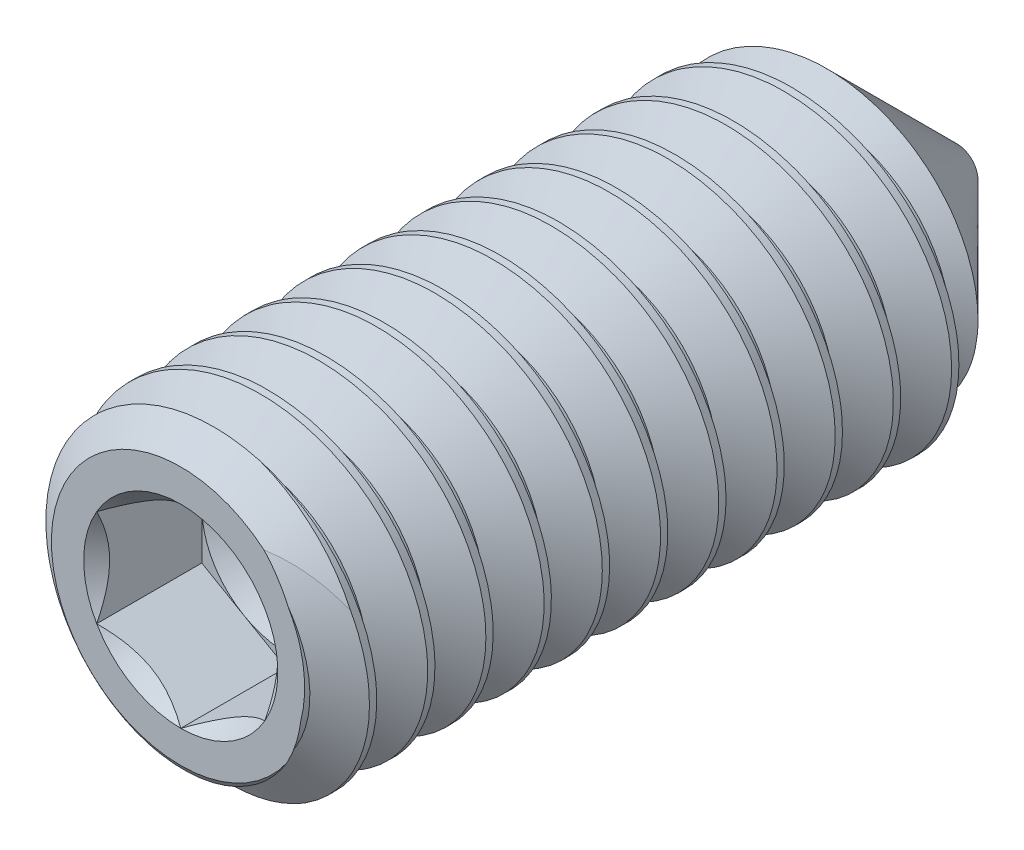
from build123d import *

# Parameters (mm, degrees)
HEX_EXTRUDE_DEPTH  = 0.8125
THREAD_SWEEP_PITCH = 0.45


with BuildPart() as part:
    # Body Sketch → Body Revolve (revolve)
    with BuildSketch(Plane(origin=(0, 0, 0), x_dir=(0, 0, -1), z_dir=(1, 0, 0)), mode=Mode.PRIVATE) as body_revolve_sk:
        Polygon((-3, 0), (-3, 1), (-2.824948115, 1.25), (1.9125, 1.25), (3, 0.1625), (3, 0), align=None)
    revolve(body_revolve_sk.sketch.rotate(Axis((0, 0, -3), (0, 0, 1)), 90), axis=Axis((0, 0, -3), (0, 0, 1)))

    # Hex Sketch → Hex Extrude (cut)
    with BuildSketch(Plane.XY.offset(3)):
        Polygon((0, 0.75055535), (-0.65, 0.375277675), (-0.65, -0.375277675), (0, -0.75055535), (0.65, -0.375277675), (0.65, 0.375277675), align=None)
    extrude(amount=-HEX_EXTRUDE_DEPTH, mode=Mode.SUBTRACT)

    # Hex Entry Extrude cone 1 section (through the dimple's axis) → Hex Entry Extrude (revolve, cut)
    with BuildSketch(Plane(origin=(0, 0, 3), x_dir=(0, -1, 0), z_dir=(1, 0, 0))):
        Polygon((0, 0), (0.75055535, 0), (0, 0.75055535), align=None)
    revolve(axis=Axis((0, 0, 3), (0, 0, -1)), mode=Mode.SUBTRACT)

    # Hex Bottom Extrude cone 1 section (through the dimple's axis) → Hex Bottom Extrude (revolve, cut)
    with BuildSketch(Plane(origin=(0, 0, 2.1875), x_dir=(0, -1, 0), z_dir=(1, 0, 0))):
        Polygon((0, 0), (0.65, 0), (0, 0.375277675), align=None)
    revolve(axis=Axis((0, 0, 2.1875), (0, 0, -1)), mode=Mode.SUBTRACT)

    # Thread Sweep: the profile of Sketch28 profile screwed along a right-hand helix of 14.333333 turns, 6 arcs to a turn; built about Z, then put on its axis
    thread_sweep_z = Axis((0, 0, 0), (0, 0, 1))
    thread_sweep_corners = [(1.2503, 0, 0.000173205), (1.2503, 0, -0.393923205), (0.957716426, 0, -0.225), (0.957716426, 0, -0.16875)]
    with BuildLine(mode=Mode.PRIVATE) as thread_sweep_profile:
        Line(thread_sweep_corners[0], thread_sweep_corners[1])
        Line(thread_sweep_corners[1], thread_sweep_corners[2])
        Line(thread_sweep_corners[2], thread_sweep_corners[3])
        Line(thread_sweep_corners[3], thread_sweep_corners[0])
    thread_sweep_cap = Face(thread_sweep_profile.wire())
    thread_sweep_turn_angles = [0, 30, 60, 90, 120, 150, 180, 210, 240, 270, 300, 330, 360]
    thread_sweep_turn_weights = [1, 0.8660254037844387, 1, 0.8660254037844387, 1, 0.8660254037844387, 1, 0.8660254037844387, 1, 0.8660254037844387, 1, 0.8660254037844387, 1]
    thread_sweep_turn_rails = [Edge.make_bspline([Vector(p[0], p[1], 0).rotate(thread_sweep_z, thread_sweep_turn_angles[k]) / thread_sweep_turn_weights[k] + Vector(0, 0, p[2] + THREAD_SWEEP_PITCH * thread_sweep_turn_angles[k] / 360) for k in range(13)], [0, 0, 0, 1, 1, 2, 2, 3, 3, 4, 4, 5, 5, 6, 6, 6], 2, thread_sweep_turn_weights) for p in thread_sweep_corners]
    thread_sweep_turn_sides = [Face.make_surface_from_curves(thread_sweep_turn_rails[p[0]], thread_sweep_turn_rails[p[1]]) for p in [(0, 1), (1, 2), (2, 3), (3, 0)]]
    thread_sweep_last_angles = [5040, 5070, 5100, 5130, 5160]
    thread_sweep_last_weights = [1, 0.8660254037844387, 1, 0.8660254037844506, 1]
    thread_sweep_last_rails = [Edge.make_bspline([Vector(p[0], p[1], 0).rotate(thread_sweep_z, thread_sweep_last_angles[k]) / thread_sweep_last_weights[k] + Vector(0, 0, p[2] + THREAD_SWEEP_PITCH * thread_sweep_last_angles[k] / 360) for k in range(5)], [0, 0, 0, 1, 1, 2, 2, 2], 2, thread_sweep_last_weights) for p in thread_sweep_corners]
    thread_sweep_last_sides = [Face.make_surface_from_curves(thread_sweep_last_rails[p[0]], thread_sweep_last_rails[p[1]]) for p in [(0, 1), (1, 2), (2, 3), (3, 0)]]
    thread_sweep = Plane(origin=(0, 0, -3), x_dir=(0, 1, 0), z_dir=(0, 0, 1)) * Solid(Shell([*[p.moved(Location((0, 0, THREAD_SWEEP_PITCH * i))) for i in range(14) for p in thread_sweep_turn_sides], *thread_sweep_last_sides, thread_sweep_cap, thread_sweep_cap.rotate(thread_sweep_z, 5160).moved(Location((0, 0, THREAD_SWEEP_PITCH * 5160 / 360)))]))
    add(thread_sweep, mode=Mode.SUBTRACT)


solid = part.part
